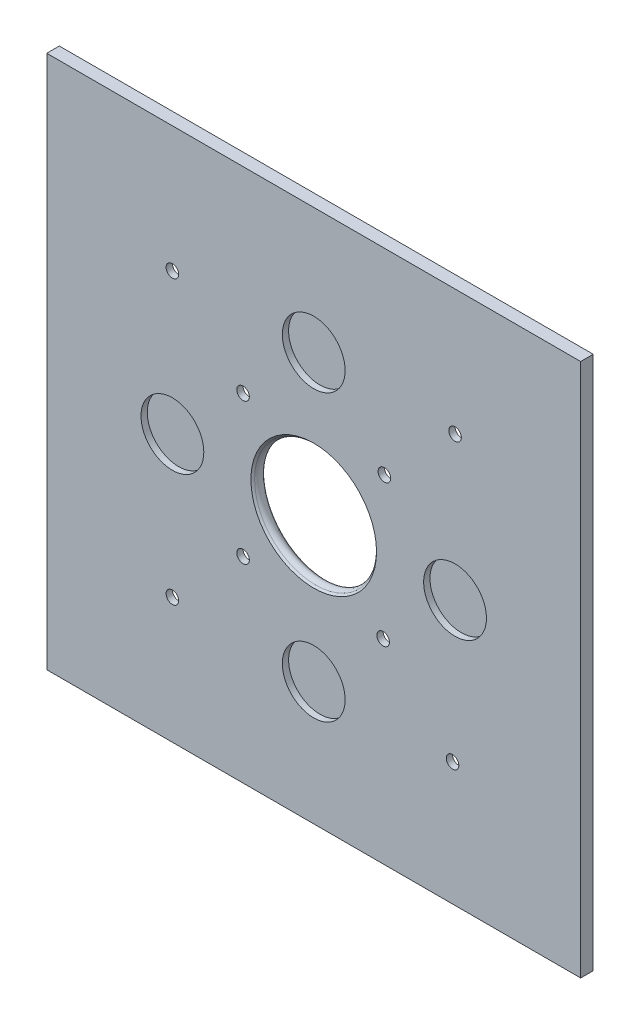
from build123d import *

# Parameters (mm, degrees)
SKETCH_1_W          = 85
SKETCH_1_H          = 85
EXTRUDE_1_DEPTH     = 2
SKETCH_2_R          = 9
CUT_EXTRUDE_1_DEPTH = 2
SKETCH_3_R          = 5
CUT_EXTRUDE_3_DEPTH = 1
SKETCH_4_R          = 5
CUT_EXTRUDE_4_DEPTH = 1
SKETCH_5_R          = 1
CUT_EXTRUDE_5_DEPTH = 94.644624303
CHAMFER_1_SIZE      = 1
CHAMFER_2_SIZE      = 1


with BuildPart() as part:
    # 草图1 → 凸台-拉伸1 (new body)
    with BuildSketch(Plane.XY):
        with Locations((27.114602804, -20.102897196)):
            Rectangle(SKETCH_1_W, SKETCH_1_H)
    extrude(amount=EXTRUDE_1_DEPTH)

    # 草图2 → 切除-拉伸1 (cut)
    with BuildSketch(Plane(origin=(0, 0, 0), x_dir=(-1, 0, 0), z_dir=(0, 0, -1))):
        with Locations((-27.114602804, -20.102897196)):
            Circle(SKETCH_2_R)
    extrude(amount=-CUT_EXTRUDE_1_DEPTH, mode=Mode.SUBTRACT)

    # 草图3 → 切除-拉伸3 (cut)
    with BuildSketch(Plane.XY.offset(2)):
        with Locations((49.614602804, -20.495049302)):
            Circle(SKETCH_3_R)
        with Locations((27.114602804, 2.397102804)):
            Circle(SKETCH_3_R)
        with Locations((27.114602804, -42.995049302)):
            Circle(SKETCH_3_R)
        with Locations((4.614602804, -20.102897196)):
            Circle(SKETCH_3_R)
    extrude(amount=-CUT_EXTRUDE_3_DEPTH, mode=Mode.SUBTRACT)

    # 草图4 → 切除-拉伸4 (cut)
    with BuildSketch(Plane(origin=(0, 0, 0), x_dir=(-1, 0, 0), z_dir=(0, 0, -1))):
        with Locations((-49.215493554, -42.995049302)):
            Circle(SKETCH_4_R)
        with Locations((-38.165048179, -31.548973249)):
            Circle(SKETCH_4_R)
        with Locations((-49.614602804, 2.397102804)):
            Circle(SKETCH_4_R)
        with Locations((-38.364602804, -8.852897196)):
            Circle(SKETCH_4_R)
        with Locations((-4.614602804, -42.602897196)):
            Circle(SKETCH_4_R)
        with Locations((-15.864602804, -31.352897196)):
            Circle(SKETCH_4_R)
        with Locations((-4.614602804, 2.397102804)):
            Circle(SKETCH_4_R)
        with Locations((-15.864602804, -8.852897196)):
            Circle(SKETCH_4_R)
    extrude(amount=-CUT_EXTRUDE_4_DEPTH, mode=Mode.SUBTRACT)

    # 草图5 → 切除-拉伸5 (cut, through all)
    with BuildSketch(Plane(origin=(0, 0, 0), x_dir=(-1, 0, 0), z_dir=(0, 0, -1))):
        with Locations((-4.614602804, -42.602897196)):
            Circle(SKETCH_5_R)
        with Locations((-15.864602804, -31.352897196)):
            Circle(SKETCH_5_R)
        with Locations((-15.864602804, -8.852897196)):
            Circle(SKETCH_5_R)
        with Locations((-4.614602804, 2.397102804)):
            Circle(SKETCH_5_R)
        with Locations((-38.364602804, -8.852897196)):
            Circle(SKETCH_5_R)
        with Locations((-49.614602804, 2.397102804)):
            Circle(SKETCH_5_R)
        with Locations((-49.215493554, -42.995049302)):
            Circle(SKETCH_5_R)
        with Locations((-38.165048179, -31.548973249)):
            Circle(SKETCH_5_R)
    extrude(amount=-CUT_EXTRUDE_5_DEPTH, mode=Mode.SUBTRACT)

    # 倒角1
    chamfer_1_edges = [part.edges().sort_by_distance(p)[0] for p in [
        (36.114602804, -20.102897196, 0),
    ]]
    chamfer(chamfer_1_edges, length=CHAMFER_1_SIZE)

    # 倒角2
    chamfer_2_edges = [part.edges().sort_by_distance(p)[0] for p in [
        (36.114602804, -20.102897196, 2),
    ]]
    chamfer(chamfer_2_edges, length=CHAMFER_2_SIZE - 0.0001)  # a hair under: the kernel refuses the full size

    # 圆角1: read off the stored shape, not the designer's step
    # 圆角1 outline → 圆角1 (revolve, cut)
    with BuildSketch(Plane(origin=(27.114602804, -20.102897196, 0), x_dir=(1, 0, 0), z_dir=(0, -1, 0))):
        with BuildLine():
            ThreePointArc((9.707106781, 0.292893219), (9.414213562, 1), (9.707106781, 1.707106781))
            Line((9.707106781, 1.707106781), (0, 1.707106781))
            Line((0, 1.707106781), (0, 0.292893219))
            Line((0, 0.292893219), (9.707106781, 0.292893219))
        make_face()
    revolve(axis=Axis((27.114602804, -20.102897196, 0), (0, 0, 1)), mode=Mode.SUBTRACT)


solid = part.part
